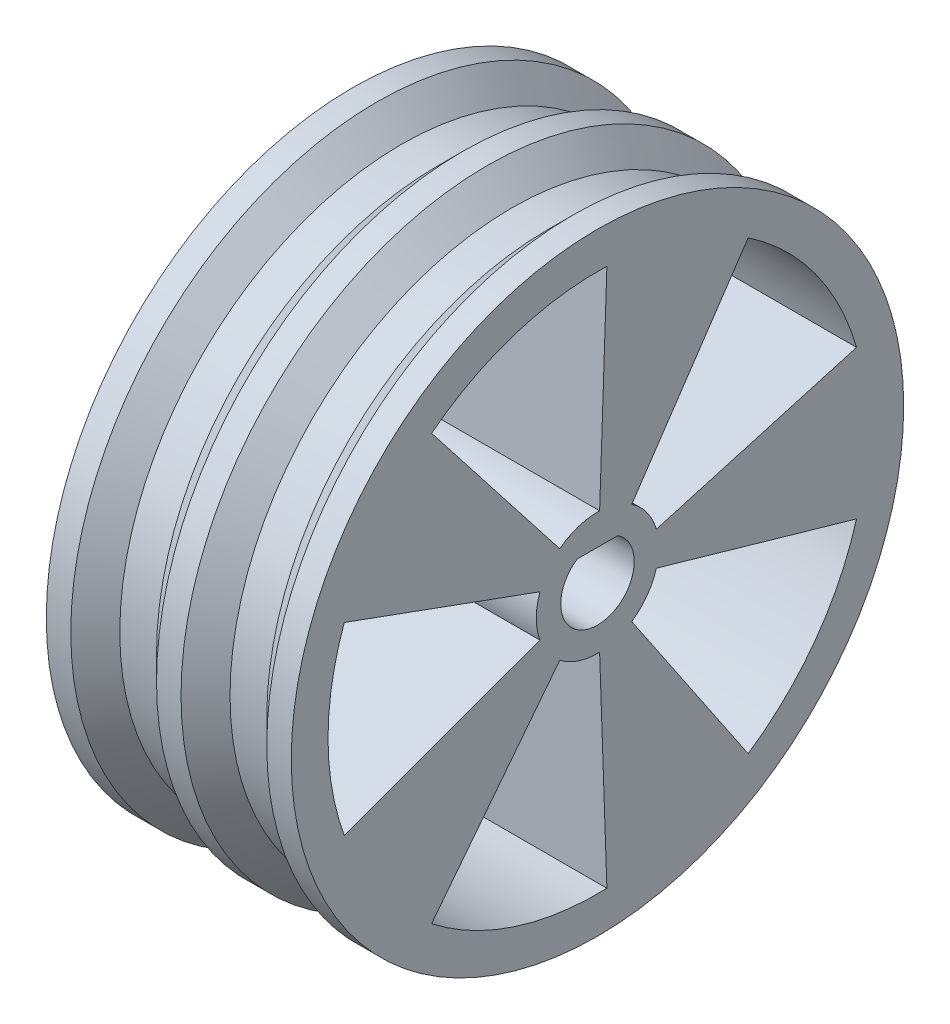
from build123d import *

# Parameters (mm, degrees)
BASE_DEPTH          = 10
BASE_DEPTH_BACK     = 10
ESQUISSE1_R         = 25
ESQUISSE2_R         = 25
ESQUISSE2_R_2       = 23
VIDE_GORGE_DEPTH    = 7
VIDE_JANTE_DEPTH    = 20
ESQUISSE6_R         = 3
VIDE_BLOC_AXE_DEPTH = 4
CHAN_SIZE           = 2


with BuildPart() as part:
    # Esquisse1 → BASE (new, two sides: drawn at the far end of the back side and taken through both)
    with BuildSketch(Plane(origin=(0, 0, 0), x_dir=(0, 0, -1), z_dir=(1, 0, 0)).offset(-BASE_DEPTH_BACK)):
        Circle(ESQUISSE1_R)
        with BuildLine():
            Line((-1.658312395, 2.5), (1.658312395, 2.5))
            ThreePointArc((1.658312395, 2.5), (0, -3), (-1.658312395, 2.5))
        make_face(mode=Mode.SUBTRACT)
    extrude(amount=BASE_DEPTH + BASE_DEPTH_BACK)

    # Esquisse2 → VIDE GORGE (cut)
    with BuildSketch(Plane.ZY.offset(8)):
        with Locations(Location((0, 0, 0), (0, 0, 180))):
            Circle(ESQUISSE2_R)
        Circle(ESQUISSE2_R_2, mode=Mode.SUBTRACT)
    vide_gorge = extrude(amount=-VIDE_GORGE_DEPTH, mode=Mode.SUBTRACT)

    # SYM GORGE: VIDE GORGE across plane
    add(vide_gorge.mirror(Plane(origin=(0, 0, 0), x_dir=(0, 0, 1), z_dir=(1, 0, 0))), mode=Mode.SUBTRACT)

    # Esquisse4 → VIDE JANTE (cut)
    with BuildSketch(Plane(origin=(10, 0, 0), x_dir=(0, 0, -1), z_dir=(1, 0, 0))):
        with BuildLine():
            Line((-22, 0), (-5, 0))
            ThreePointArc((-5, 0), (-4.924038765, 0.868240888), (-4.698463104, 1.710100717))
            Line((-4.698463104, 1.710100717), (-20.673237657, 7.524443153))
            ThreePointArc((-20.673237657, 7.524443153), (-21.665770566, 3.820259909), (-22, 0))
        make_face()
        with BuildLine():
            ThreePointArc((-4.698463104, -1.710100717), (-4.924038765, -0.868240888), (-5, 0))
            Line((-5, 0), (-22, 0))
            ThreePointArc((-22, 0), (-21.665770566, -3.820259909), (-20.673237657, -7.524443153))
            Line((-20.673237657, -7.524443153), (-4.698463104, -1.710100717))
        make_face()
        with BuildLine():
            Line((-13.544552457, 17.336236579), (-3.078307377, 3.940053768))
            ThreePointArc((-3.078307377, 3.940053768), (-1.545084972, 4.755282581), (0.174497484, 4.996954135))
            Line((0.174497484, 4.996954135), (0.767788927, 21.986598194))
            ThreePointArc((0.767788927, 21.986598194), (-6.798373876, 20.923243358), (-13.544552457, 17.336236579))
        make_face()
        with BuildLine():
            Line((12.302243876, 18.238826596), (2.795964517, 4.145187863))
            ThreePointArc((2.795964517, 4.145187863), (4.045084972, 2.938926261), (4.80630848, 1.378186779))
            Line((4.80630848, 1.378186779), (21.147757311, 6.064021828))
            ThreePointArc((21.147757311, 6.064021828), (17.798373876, 12.93127555), (12.302243876, 18.238826596))
        make_face()
        with BuildLine():
            ThreePointArc((4.80630848, -1.378186779), (4.045084972, -2.938926261), (2.795964517, -4.145187863))
            Line((2.795964517, -4.145187863), (12.302243876, -18.238826596))
            ThreePointArc((12.302243876, -18.238826596), (17.798373876, -12.93127555), (21.147757311, -6.064021828))
            Line((21.147757311, -6.064021828), (4.80630848, -1.378186779))
        make_face()
        with BuildLine():
            ThreePointArc((0.174497484, -4.996954135), (-1.545084972, -4.755282581), (-3.078307377, -3.940053768))
            Line((-3.078307377, -3.940053768), (-13.544552457, -17.336236579))
            ThreePointArc((-13.544552457, -17.336236579), (-6.798373876, -20.923243358), (0.767788927, -21.986598194))
            Line((0.767788927, -21.986598194), (0.174497484, -4.996954135))
        make_face()
    extrude(amount=-VIDE_JANTE_DEPTH, mode=Mode.SUBTRACT)

    # Esquisse6 → VIDE BLOC AXE (cut)
    with BuildSketch(Plane.ZY.offset(10)):
        with Locations(Location((0, 0, 0), (0, 0, 180))):
            Circle(ESQUISSE6_R)
    extrude(amount=-VIDE_BLOC_AXE_DEPTH, mode=Mode.SUBTRACT)

    # CHAN
    chan_edges = [part.edges().sort_by_distance(p)[0] for p in [
        (-1, 0, -23),
        (-8, 0, -23),
        (8, 0, -23),
        (1, 0, -23),
    ]]
    chamfer(chan_edges, length=CHAN_SIZE - 0.0001)  # a hair under: the kernel refuses the full size


solid = part.part
